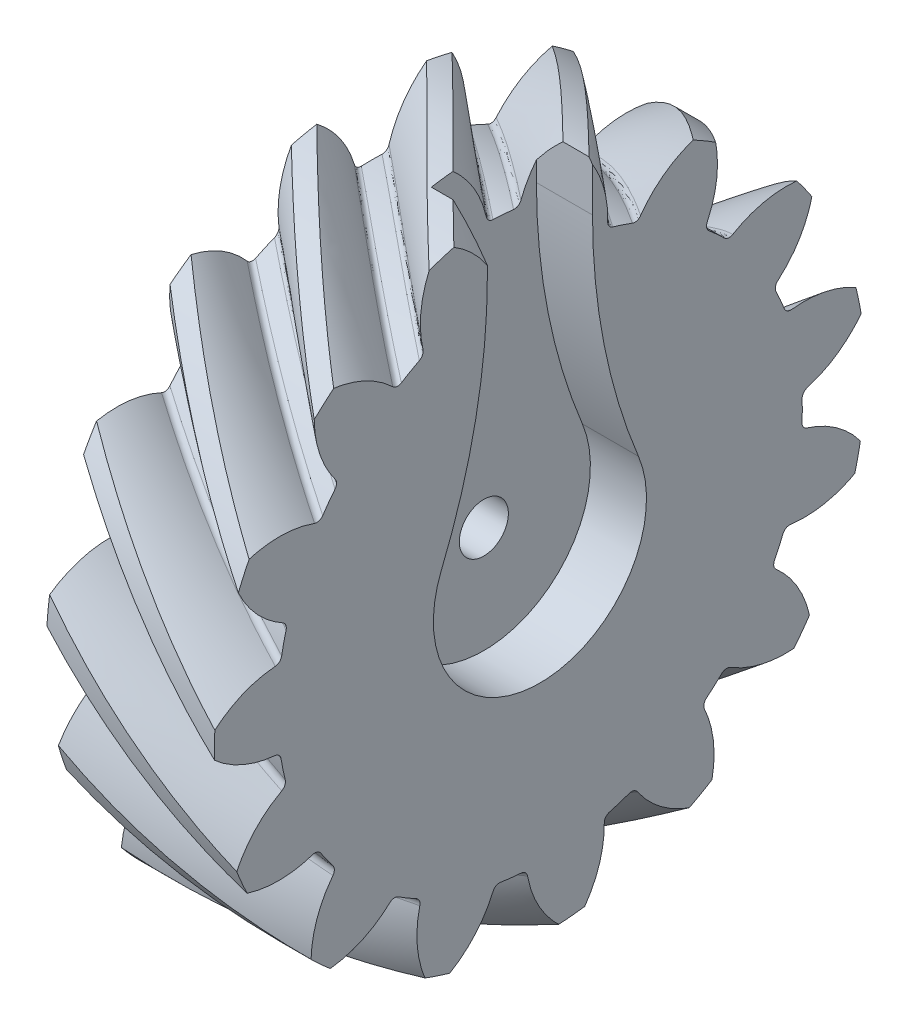
from build123d import *

# Parameters (mm, degrees)
BASPROSKE_W            = 12
BASPROSKE_H            = 23.213203436
TOOTHCUTRH_PITCH       = 145.852858759
TOOTHCUTRH_HEIGHT      = 12
TOOTHCUTRH_RADIUS      = 23.213203436
TOOTHCUTRH_START_ANGLE = -90
TEETHCUTSRH_COUNT      = 15
TEETHCUTSRH_ANGLE      = 336
BORSKE_R               = 1.5
BORE_DEPTH             = 62.5000025
CUT_EXTRUDE1_DEPTH     = 4
SKETCH4_R              = 1.75
CUT_EXTRUDE2_DEPTH     = 34.789134922


with BuildPart() as part:
    # BasProSke → Base-Revolve (revolve)
    with BuildSketch(Plane(origin=(0, 0, 0), x_dir=(1, 0, 0), z_dir=(0, 1, 0)), mode=Mode.PRIVATE) as base_revolve_sk:
        with Locations((6, 11.606601718)):
            Rectangle(BASPROSKE_W, BASPROSKE_H)
    revolve(base_revolve_sk.sketch.rotate(Axis((-10, 0, 0), (1, 0, 0)), 180), axis=Axis((-10, 0, 0), (1, 0, 0)))

    # ToothCutRH: sweep along a helix
    with BuildLine() as toothcutrh_path:
        add(Helix(TOOTHCUTRH_PITCH, TOOTHCUTRH_HEIGHT, TOOTHCUTRH_RADIUS, center=(0, 0, 0), direction=(1, 0, 0), mode=Mode.PRIVATE).rotate(Axis((0, 0, 0), (1, 0, 0)), TOOTHCUTRH_START_ANGLE))
    # TooCutSkeRH → ToothCutRH (sweep, cut)
    with BuildSketch(Plane(origin=(0, 0, 0), x_dir=(0, 0, -1), z_dir=(1, 0, 0))):
        with BuildLine():
            ThreePointArc((0.737932466, 18.698648039), (0, 18.713203436), (-0.737932466, 18.698648039))
            ThreePointArc((-0.737932466, 18.698648039), (-1.048225915, 18.791104975), (-1.237176833, 19.05402675))
            ThreePointArc((-1.237176833, 19.05402675), (-2.574531721, 21.584927745), (-4.762692437, 23.430444103))
            ThreePointArc((-4.762692437, 23.430444103), (0, 23.909599539), (4.762692437, 23.430444103))
            ThreePointArc((4.762692437, 23.430444103), (2.574531721, 21.584927745), (1.237176833, 19.05402675))
            ThreePointArc((1.237176833, 19.05402675), (1.048225915, 18.791104975), (0.737932466, 18.698648039))
        make_face()
    toothcutrh = sweep(path=toothcutrh_path.line, is_frenet=True, mode=Mode.SUBTRACT)

    # TeethCutsRH: ToothCutRH ×15 about axis
    teethcutsrh_axis = Axis((-10, 0, 0), (1, 0, 0))
    for i in range(1, TEETHCUTSRH_COUNT):
        add(toothcutrh.rotate(teethcutsrh_axis, i * TEETHCUTSRH_ANGLE / (TEETHCUTSRH_COUNT - 1)), mode=Mode.SUBTRACT)

    # BorSke → Bore (cut, symmetric)
    with BuildSketch(Plane(origin=(0, 0, 0), x_dir=(0, 0, -1), z_dir=(1, 0, 0))):
        with Locations(Location((0, 0, 0), (0, 0, 180))):
            Circle(BORSKE_R)
    extrude(amount=BORE_DEPTH, both=True, mode=Mode.SUBTRACT)

    # Sketch3 → Cut-Extrude1 (cut)
    with BuildSketch(Plane(origin=(12, 0, 0), x_dir=(0, 0, -1), z_dir=(1, 0, 0))):
        with BuildLine():
            Line((-3.75, 26.675732666), (3.75, 26.675732666))
            Line((3.75, 26.675732666), (3.75, 19.43907148))
            ThreePointArc((3.75, 19.43907148), (4.576946984, 11.007277076), (7.02627451, 2.896802809))
            ThreePointArc((7.02627451, 2.896802809), (0, -7.6), (-7.02627451, 2.896802809))
            ThreePointArc((-7.02627451, 2.896802809), (-4.576946984, 11.007277076), (-3.75, 19.43907148))
            Line((-3.75, 19.43907148), (-3.75, 26.675732666))
        make_face()
    extrude(amount=-CUT_EXTRUDE1_DEPTH, mode=Mode.SUBTRACT)

    # Sketch4 → Cut-Extrude2 (cut, through all)
    with BuildSketch(Plane(origin=(8, 0, 0), x_dir=(0, 0, -1), z_dir=(1, 0, 0))):
        Circle(SKETCH4_R)
    extrude(amount=-CUT_EXTRUDE2_DEPTH, mode=Mode.SUBTRACT)


solid = part.part
